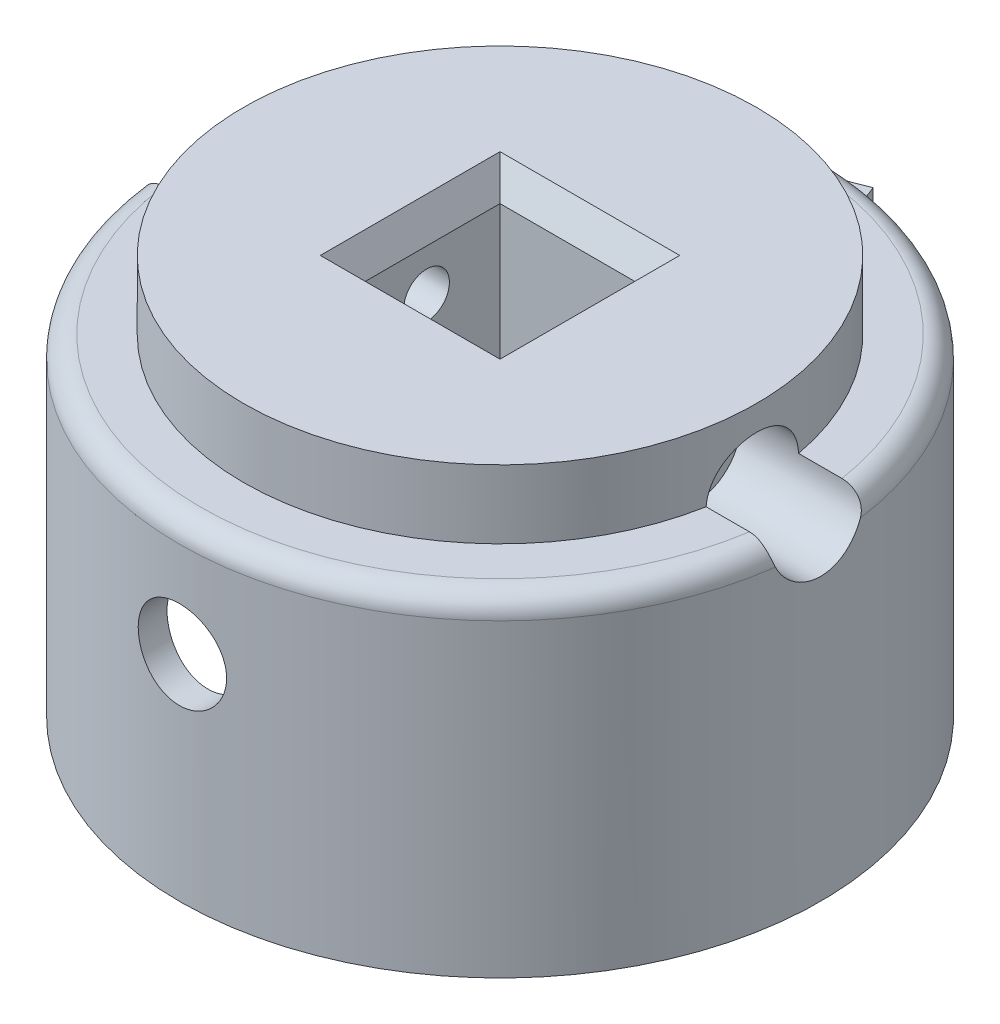
from build123d import *
from OCP.BRepFilletAPI import BRepFilletAPI_MakeChamfer

# Parameters (mm, degrees)
SKETCH1_R                = 22.5
BOSS_EXTRUDE1_DEPTH      = 28
SKETCH2_W                = 10.3
SKETCH2_H                = 10.3
CUT_EXTRUDE2_DEPTH       = 43.385138905
SHELL3_T                 = -2
SKETCH3_R                = 3.1
CUT_EXTRUDE3_DEPTH       = 47.576523056
CHAMFER1_SIZE            = 2
CHAMFER1_SIZE2           = 1.154700538
BOSS_EXTRUDE8_START      = 23
BOSS_EXTRUDE8_DEPTH      = 23
BOSS_EXTRUDE4_DEPTH      = 20
BOSS_EXTRUDE6_DEPTH      = 26
CUT_EXTRUDE5_DEPTH       = 12
SKETCH13_R               = 3.8
CUT_EXTRUDE6_DEPTH       = 16
SKETCH15_W               = 10
SKETCH15_H               = 3
CUT_EXTRUDE8_DEPTH       = 16
CUT_EXTRUDE9_DEPTH       = 2
BOSS_EXTRUDE10_START     = 7
BOSS_EXTRUDE10_DEPTH     = 7
SKETCH21_OUTSIDE_W       = 61.262
SKETCH21_OUTSIDE_H       = 63.966
SKETCH21_OUTSIDE_R       = 18
CUT_EXTRUDE11_DEPTH      = 4.8
CUT_EXTRUDE12_DEPTH      = 47.730672242
CUT_EXTRUDE12_DEPTH_BACK = 47.730672242
SKETCH22_R               = 1.6
CUT_EXTRUDE13_START      = -8.5
SKETCH24_R               = 3.25
CUT_EXTRUDE13_DEPTH      = 39.230672302
CUT_EXTRUDE14_START      = -8.5
CUT_EXTRUDE14_DEPTH      = 39.230672304
FILLET1_R                = 1.5


with BuildPart() as part:
    # Sketch1 → Boss-Extrude1 (new body)
    with BuildSketch(Plane(origin=(0, 0, 0), x_dir=(1, 0, 0), z_dir=(0, 1, 0))):
        with Locations(Location((0, 0, 0), (0, 0, 270))):
            Circle(SKETCH1_R)
    extrude(amount=BOSS_EXTRUDE1_DEPTH)

    # Sketch2 → Cut-Extrude2 (cut, through all)
    with BuildSketch(Plane.XZ):
        Rectangle(SKETCH2_W, SKETCH2_H)
    extrude(amount=-CUT_EXTRUDE2_DEPTH, mode=Mode.SUBTRACT)

    # Shell3
    shell3_openings = [part.faces().sort_by_distance(p)[0] for p in [
        (0, 0, -21.863603897),
    ]]
    offset(amount=SHELL3_T, openings=shell3_openings, kind=Kind.INTERSECTION)

    # Sketch3 → Cut-Extrude3 (cut, through all)
    with BuildSketch(Plane.XY.offset(7.15)):
        with Locations(Location((0, 15, 0), (0, 0, 270.000000016))):
            Circle(SKETCH3_R)
    extrude(amount=CUT_EXTRUDE3_DEPTH, mode=Mode.SUBTRACT)

    # Chamfer1: one chamfer whose edges measure the first distance from different faces: ONE call of the kernel's chamfer builder (chamfer() names one face for all edges)
    chamfer1_edges_1 = [part.edges().sort_by_distance(p)[0] for p in [
        (5.15, 28, 0),
    ]]
    chamfer1_side_1 = [part.faces().sort_by_distance(p)[0] for p in [
        (5.15, 14, 0),
    ]]
    chamfer1_edges_2 = [part.edges().sort_by_distance(p)[0] for p in [
        (0, 28, -5.15),
    ]]
    chamfer1_side_2 = [part.faces().sort_by_distance(p)[0] for p in [
        (0, 14, -5.15),
    ]]
    chamfer1_edges_3 = [part.edges().sort_by_distance(p)[0] for p in [
        (-5.15, 28, 0),
    ]]
    chamfer1_side_3 = [part.faces().sort_by_distance(p)[0] for p in [
        (-5.15, 14, 0),
    ]]
    chamfer1_edges_4 = [part.edges().sort_by_distance(p)[0] for p in [
        (0, 28, 5.15),
    ]]
    chamfer1_side_4 = [part.faces().sort_by_distance(p)[0] for p in [
        (0, 14, 5.15),
    ]]
    chamfer1 = BRepFilletAPI_MakeChamfer(part.part.solid().wrapped)
    for e in chamfer1_edges_1:
        chamfer1.Add(CHAMFER1_SIZE, CHAMFER1_SIZE2, e.wrapped, chamfer1_side_1[0].wrapped)  # the first distance lies on this face
    for e in chamfer1_edges_2:
        chamfer1.Add(CHAMFER1_SIZE, CHAMFER1_SIZE2, e.wrapped, chamfer1_side_2[0].wrapped)  # the first distance lies on this face
    for e in chamfer1_edges_3:
        chamfer1.Add(CHAMFER1_SIZE, CHAMFER1_SIZE2, e.wrapped, chamfer1_side_3[0].wrapped)  # the first distance lies on this face
    for e in chamfer1_edges_4:
        chamfer1.Add(CHAMFER1_SIZE, CHAMFER1_SIZE2, e.wrapped, chamfer1_side_4[0].wrapped)  # the first distance lies on this face
    add(Compound.cast(chamfer1.Shape()), mode=Mode.REPLACE)

    # Sketch18 → Boss-Extrude8 (add)
    with BuildSketch(Plane.XZ.offset(-26).offset(BOSS_EXTRUDE8_START)):
        with BuildLine():
            Line((-15.72889581, -7.671495069), (-18.425277949, -8.986608509))
            ThreePointArc((-18.425277949, -8.986608509), (-20.471905462, 1.072887103), (-17.384985971, 10.863344917))
            Line((-17.384985971, 10.863344917), (-14.840841683, 9.273587124))
            ThreePointArc((-14.840841683, 9.273587124), (-17.476016858, 0.915879234), (-15.72889581, -7.671495069))
        make_face()
    extrude(amount=-BOSS_EXTRUDE8_DEPTH)

    # Sketch9 → Boss-Extrude4 (add)
    with BuildSketch(Plane.XZ):
        Polygon((2.057061598, -22.405769292), (-16.596699733, -15.192088664), (-17.678751827, -17.990152864), (0.975009504, -25.203833492), align=None)
    extrude(amount=-BOSS_EXTRUDE4_DEPTH)

    # Sketch11 → Boss-Extrude6 (add)
    with BuildSketch(Plane.XZ):
        with BuildLine():
            Line((2.057061598, -22.405769292), (7.15, -7.15))
            Line((7.15, -7.15), (-7.15, -7.15))
            Line((-7.15, -7.15), (-16.596699733, -15.192088664))
            ThreePointArc((-16.596699733, -15.192088664), (-8.115390707, -20.985481497), (2.057061598, -22.405769292))
        make_face()
    extrude(amount=-BOSS_EXTRUDE6_DEPTH)

    # Sketch12 → Cut-Extrude5 (cut)
    with BuildSketch(Plane.XZ):
        with BuildLine():
            Line((3.835926277, -17.077224747), (2.755377072, -20.3139828))
            ThreePointArc((2.755377072, -20.3139828), (-6.94485615, -19.287793369), (-15.072724539, -13.894710323))
            Line((-15.072724539, -13.894710323), (-12.788386178, -11.950025708))
            ThreePointArc((-12.788386178, -11.950025708), (-5.15835992, -16.725347781), (3.835926277, -17.077224747))
        make_face()
    extrude(amount=-CUT_EXTRUDE5_DEPTH, mode=Mode.SUBTRACT)

    # Sketch13 → Cut-Extrude6 (cut)
    with BuildSketch(Plane(origin=(-8.351871161, 0, -21.596993178), x_dir=(-0.9326880665539258, 0, 0.3606840314013081), z_dir=(-0.3606840314013081, 0, -0.9326880665539258))):
        with Locations((0, 10)):
            Circle(SKETCH13_R)
    extrude(amount=-CUT_EXTRUDE6_DEPTH, mode=Mode.SUBTRACT)

    # Sketch15 → Cut-Extrude8 (cut)
    with BuildSketch(Plane(origin=(-8.351871161, 0, -21.596993178), x_dir=(-0.9326880665539258, 0, 0.3606840314013081), z_dir=(-0.3606840314013081, 0, -0.9326880665539258))):
        with Locations((0, 10)):
            Rectangle(SKETCH15_W, SKETCH15_H)
    extrude(amount=-CUT_EXTRUDE8_DEPTH, mode=Mode.SUBTRACT)

    # Sketch17 → Cut-Extrude9 (cut)
    with BuildSketch(Plane.XZ):
        with BuildLine():
            Line((7.15, 7.15), (7.15, -7.15))
            Line((7.15, -7.15), (3.835926277, -17.077224747))
            ThreePointArc((3.835926277, -17.077224747), (-5.15835992, -16.725347781), (-12.788386178, -11.950025708))
            Line((-12.788386178, -11.950025708), (-7.15, -7.15))
            Line((-7.15, -7.15), (-7.15, 7.15))
            Line((-7.15, 7.15), (7.15, 7.15))
        make_face()
    extrude(amount=-CUT_EXTRUDE9_DEPTH, mode=Mode.SUBTRACT)

    # Sketch20 → Boss-Extrude10 (add)
    with BuildSketch(Plane.XZ.offset(-26).offset(BOSS_EXTRUDE10_START)):
        with BuildLine():
            Line((2.755377072, -20.3139828), (7.15, -7.15))
            Line((7.15, -7.15), (7.15, 7.15))
            Line((7.15, 7.15), (-7.15, 7.15))
            Line((-7.15, 7.15), (-7.15, -7.15))
            Line((-7.15, -7.15), (-15.072724539, -13.894710323))
            ThreePointArc((-15.072724539, -13.894710323), (6.94485615, 19.287793369), (2.755377072, -20.3139828))
        make_face()
    extrude(amount=-BOSS_EXTRUDE10_DEPTH)

    # Sketch21 outside → Cut-Extrude11 (cut)
    with BuildSketch(Plane(origin=(0, 28, 0), x_dir=(1, 0, 0), z_dir=(0, 1, 0))):
        with Locations((0, 1.352)):
            Rectangle(SKETCH21_OUTSIDE_W, SKETCH21_OUTSIDE_H)
        with Locations(Location((0, 0, 0), (0, 0, 270))):
            Circle(SKETCH21_OUTSIDE_R, mode=Mode.SUBTRACT)
    extrude(amount=-CUT_EXTRUDE11_DEPTH, mode=Mode.SUBTRACT)

    # Sketch22 → Cut-Extrude12 (cut, two sides: drawn at the far end of the back side and taken through both)
    with BuildSketch(Plane.ZY.offset(-5.15).offset(-CUT_EXTRUDE12_DEPTH_BACK)):
        with Locations((0, 23)):
            Circle(SKETCH22_R)
    extrude(amount=CUT_EXTRUDE12_DEPTH + CUT_EXTRUDE12_DEPTH_BACK, mode=Mode.SUBTRACT)

    # Sketch24 → Cut-Extrude13 (cut, through all)
    with BuildSketch(Plane.ZY.offset(-5.15).offset(CUT_EXTRUDE13_START)):
        with Locations((0, 23)):
            Circle(SKETCH24_R)
    extrude(amount=-CUT_EXTRUDE13_DEPTH, mode=Mode.SUBTRACT)

    # Sketch25 → Cut-Extrude14 (cut, through all)
    with BuildSketch(Plane(origin=(-5.15, 0, 0), x_dir=(0, 0, -1), z_dir=(1, 0, 0)).offset(CUT_EXTRUDE14_START)):
        Polygon((0, 19.75), (2.814582562, 21.375), (2.814582562, 24.625), (0, 26.25), (-2.814582562, 24.625), (-2.814582562, 21.375), align=None)
    extrude(amount=-CUT_EXTRUDE14_DEPTH, mode=Mode.SUBTRACT)

    # Fillet1
    # the kernel refuses this fillet: 1.5 mm, written as the material it takes off along each edge
    with BuildSketch(Plane(origin=(0, 23.2, 0), x_dir=(0, 0, 1), z_dir=(1, 0, 0))) as fillet1_piece_1:
        with BuildLine():
            CenterArc((22.5 - FILLET1_R, FILLET1_R), FILLET1_R, 270, 90)
            Line((22.5, FILLET1_R), (22.5, 0))
            Line((22.5, 0), (22.5 - FILLET1_R, 0))
        make_face()
    revolve(axis=Axis((0, 23.2, 0), (0, -1, 0)), revolution_arc=92.366443414, mode=Mode.SUBTRACT)
    with BuildSketch(Plane(origin=(0, 23.2, 0), x_dir=(-0.9991402664664062, 0, 0.041457543649361384), z_dir=(0.041457543649361384, 0, 0.9991402664664062))) as fillet1_piece_2:
        with BuildLine():
            CenterArc((22.5 - FILLET1_R, FILLET1_R), FILLET1_R, 270, 90)
            Line((22.5, FILLET1_R), (22.5, 0))
            Line((22.5, 0), (22.5 - FILLET1_R, 0))
        make_face()
    revolve(axis=Axis((0, 23.2, 0), (0, -1, 0)), revolution_arc=183.648889302, mode=Mode.SUBTRACT)
    with BuildSketch(Plane(origin=(0, 23.2, 0), x_dir=(0.9997569746526436, 0, -0.022045217925738058), z_dir=(-0.022045217925738058, 0, -0.9997569746526436))) as fillet1_piece_3:
        with BuildLine():
            CenterArc((22.5 - FILLET1_R, FILLET1_R), FILLET1_R, 270, 90)
            Line((22.5, FILLET1_R), (22.5, 0))
            Line((22.5, 0), (22.5 - FILLET1_R, 0))
        make_face()
    revolve(axis=Axis((0, 23.2, 0), (0, -1, 0)), revolution_arc=91.263200277, mode=Mode.SUBTRACT)


solid = part.part
